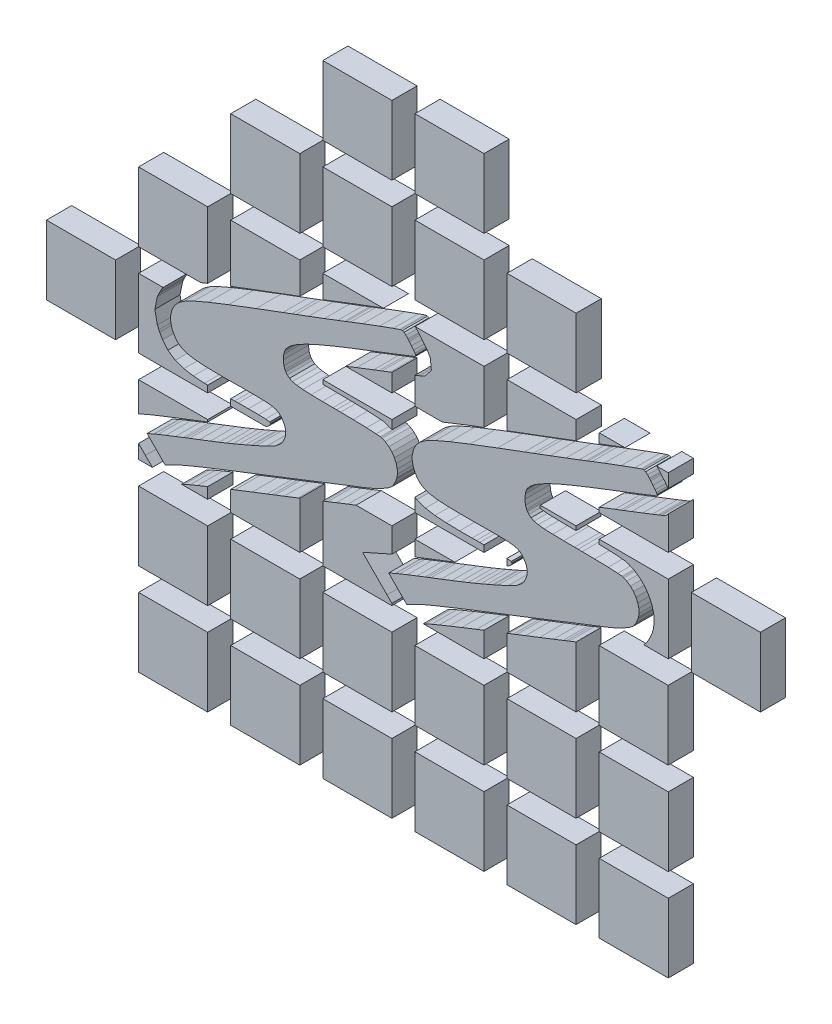
from build123d import *

# Parameters (mm, degrees)
AUFSATZ_LINEAR_AUSTRAGEN1_DEPTH       = 5
AUFSATZ_LINEAR_AUSTRAGEN1_2_DEPTH     = 5
AUFSATZ_LINEAR_AUSTRAGEN5_OUTLINE_W   = 13.7270744
AUFSATZ_LINEAR_AUSTRAGEN5_OUTLINE_H   = 13.727325352
AUFSATZ_LINEAR_AUSTRAGEN5_OUTLINE_W_2 = 13.730713204
AUFSATZ_LINEAR_AUSTRAGEN5_OUTLINE_W_3 = 13.73083868
AUFSATZ_LINEAR_AUSTRAGEN5_OUTLINE_H_2 = 13.730775942
AUFSATZ_LINEAR_AUSTRAGEN5_OUTLINE_W_4 = 13.72958392
AUFSATZ_LINEAR_AUSTRAGEN5_OUTLINE_W_5 = 13.730399514
AUFSATZ_LINEAR_AUSTRAGEN5_OUTLINE_H_3 = 13.730805993
AUFSATZ_LINEAR_AUSTRAGEN5_OUTLINE_W_6 = 13.7302113
AUFSATZ_LINEAR_AUSTRAGEN5_OUTLINE_H_4 = 13.73083868
AUFSATZ_LINEAR_AUSTRAGEN5_OUTLINE_H_5 = 13.73052499
AUFSATZ_LINEAR_AUSTRAGEN5_OUTLINE_W_7 = 13.73052499
AUFSATZ_LINEAR_AUSTRAGEN5_DEPTH       = 5


# Read off the part's stored shape, not the designer's step: Aufsatz-Linear austragen5
with BuildPart() as part:
    # Skizze1 → Aufsatz-Linear austragen1 (new body)
    with BuildSketch(Plane.XY):
        Polygon((16.2714138, 23.9861344), (14.4758116, 25.795478), (15.7643028, 26.368756), (15.9406804, 26.448766), (16.6710574, 26.747724), (18.1910188, 27.355546), (20.1078806, 28.107894), (21.6857032, 28.72105), (22.2135152, 28.922218), (22.8790968, 29.178504), (24.880058, 29.947616), (27.032454, 30.77845), (28.781244, 31.461964), (30.240474, 32.0421), (31.523428, 32.564324), (32.743136, 33.075626), (34.009326, 33.619948), (35.08146, 34.087054), (35.439854, 34.242756), (36.141148, 34.550096), (38.230552, 35.507676), (39.958768, 36.428426), (40.952162, 37.215318), (41.426126, 37.846254), (41.546268, 38.075362), (41.660568, 38.295834), (41.919394, 38.999922), (42.02836, 39.854378), (41.872404, 40.672766), (41.579034, 41.298368), (41.452288, 41.487344), (41.358562, 41.626282), (41.058334, 42.032682), (40.643298, 42.446194), (40.1005, 42.742612), (39.330118, 42.94124), (38.223694, 43.059604), (36.681406, 43.114722), (34.597844, 43.12285), (32.55162, 43.110404), (31.8709, 43.1038), (31.050988, 43.096688), (28.590998, 43.093894), (26.00731, 43.146472), (24.01595, 43.28414), (22.5235476, 43.531028), (21.426674, 43.911266), (20.63013, 44.448476), (20.0334332, 45.166534), (19.6476072, 45.853096), (19.5387428, 46.089824), (19.3830154, 46.42485), (19.0743546, 47.943262), (19.3844124, 49.460404), (19.5401144, 49.793906), (19.6434924, 50.017172), (20.011386, 50.660554), (20.7155756, 51.450494), (21.8910622, 52.2732), (23.778968, 53.240432), (26.617672, 54.465728), (30.649922, 56.057038), (36.112446, 58.127138), (41.46321, 60.123832), (43.248068, 60.786772), (44.075854, 61.095382), (46.559212, 62.02299), (49.70805, 63.206376), (52.338728, 64.202818), (53.694834, 64.722248), (54.0959, 64.87795), (54.903366, 65.195196), (57.33821, 66.12636), (60.663578, 67.37096), (63.388998, 68.358766), (64.64325, 68.793106), (64.83756, 68.841366), (64.922904, 68.86321), (65.19316, 68.874132), (65.527932, 68.750434), (65.908424, 68.427854), (66.281804, 68.008754), (66.400422, 67.864228), (66.546472, 67.684904), (66.98894, 67.1449), (67.416168, 66.614294), (67.693028, 66.239644), (67.83349, 65.985898), (67.85, 65.820544), (67.756274, 65.707768), (67.564504, 65.615312), (67.356732, 65.534032), (67.287644, 65.5066), (66.900802, 65.352168), (65.737482, 64.891666), (63.816226, 64.140588), (61.688722, 63.319406), (60.061344, 62.695328), (59.519816, 62.488572), (58.40374, 62.064138), (55.060338, 60.774072), (51.408834, 59.3217), (48.481738, 58.0898), (46.199548, 57.041034), (44.484032, 56.137048), (43.251878, 55.33771), (42.425362, 54.603396), (42.022772, 54.086506), (41.924982, 53.89499), (41.820334, 53.692552), (41.631612, 53.01869), (41.544744, 52.022248), (41.660568, 51.057556), (41.8658, 50.451512), (41.978576, 50.277776), (42.05884, 50.155094), (42.332906, 49.803812), (42.75861, 49.43856), (43.351446, 49.16551), (44.204378, 48.973994), (45.41164, 48.845978), (47.069244, 48.768762), (49.271424, 48.72736), (51.400452, 48.709326), (52.111398, 48.705516), (52.934104, 48.702722), (55.403746, 48.669448), (58.07989, 48.599344), (59.989716, 48.49876), (60.822074, 48.420274), (60.984634, 48.376078), (61.189866, 48.32096), (61.783972, 48.055022), (62.498982, 47.565818), (63.113662, 46.940216), (63.608454, 46.208188), (63.969388, 45.402246), (64.176144, 44.551854), (64.214752, 43.689524), (64.12636, 43.046904), (64.065654, 42.841672), (64.021712, 42.698416), (63.693798, 41.911778), (63.310766, 41.233852), (63.240662, 41.14419), (63.078102, 40.937434), (62.431672, 40.440102), (61.050928, 39.618666), (59.160152, 38.714426), (57.409838, 37.984176), (56.82005, 37.75964), (56.448194, 37.619178), (55.333388, 37.187632), (53.30215, 36.3982), (50.992528, 35.49269), (49.250596, 34.806382), (48.671984, 34.576258), (48.046128, 34.329624), (46.168052, 33.590992), (43.363638, 32.492696), (40.599356, 31.415228), (38.814752, 30.722062), (38.2209, 30.491938), (37.23284, 30.111446), (34.26866, 28.96362), (30.831786, 27.624278), (27.889704, 26.465276), (25.417522, 25.478486), (23.3958598, 24.6558562), (21.8015018, 23.9861344), (20.61362, 23.4638596), (20.0072712, 23.1799638), (19.8101926, 23.0766366), (18.0669906, 22.1753938), align=None)
    extrude(amount=AUFSATZ_LINEAR_AUSTRAGEN1_DEPTH)


with BuildPart() as body_2:
    # Skizze1 → Aufsatz-Linear austragen1 2 (new body)
    with BuildSketch(Plane.XY):
        Polygon((-31.7285862, 23.9861344), (-33.5241884, 25.795478), (-32.2356972, 26.368756), (-32.0593196, 26.448766), (-31.3289426, 26.747724), (-29.8089812, 27.355546), (-27.8921194, 28.107894), (-26.3142968, 28.72105), (-25.7864848, 28.922218), (-25.1209032, 29.178504), (-23.119942, 29.947616), (-20.967546, 30.77845), (-19.218756, 31.461964), (-17.759526, 32.0421), (-16.476572, 32.564324), (-15.256864, 33.075626), (-13.990674, 33.619948), (-12.91854, 34.087054), (-12.560146, 34.242756), (-11.858852, 34.550096), (-9.769448, 35.507676), (-8.041232, 36.428426), (-7.047838, 37.215318), (-6.573874, 37.846254), (-6.453732, 38.075362), (-6.339432, 38.295834), (-6.080606, 38.999922), (-5.97164, 39.854378), (-6.127596, 40.672766), (-6.420966, 41.298368), (-6.547712, 41.487344), (-6.641438, 41.626282), (-6.941666, 42.032682), (-7.356702, 42.446194), (-7.8995, 42.742612), (-8.669882, 42.94124), (-9.776306, 43.059604), (-11.318594, 43.114722), (-13.402156, 43.12285), (-15.44838, 43.110404), (-16.1291, 43.1038), (-16.949012, 43.096688), (-19.409002, 43.093894), (-21.99269, 43.146472), (-23.98405, 43.28414), (-25.4764524, 43.531028), (-26.573326, 43.911266), (-27.36987, 44.448476), (-27.9665668, 45.166534), (-28.3523928, 45.853096), (-28.4612572, 46.089824), (-28.6169846, 46.42485), (-28.9256454, 47.943262), (-28.6155876, 49.460404), (-28.4598856, 49.793906), (-28.3565076, 50.017172), (-27.988614, 50.660554), (-27.2844244, 51.450494), (-26.1089378, 52.2732), (-24.221032, 53.240432), (-21.382328, 54.465728), (-17.350078, 56.057038), (-11.887554, 58.127138), (-6.53679, 60.123832), (-4.751932, 60.786772), (-3.924146, 61.095382), (-1.440788, 62.02299), (1.70805, 63.206376), (4.338728, 64.202818), (5.694834, 64.722248), (6.0959, 64.87795), (6.903366, 65.195196), (9.33821, 66.12636), (12.663578, 67.37096), (15.388998, 68.358766), (16.64325, 68.793106), (16.83756, 68.841366), (16.922904, 68.86321), (17.19316, 68.874132), (17.527932, 68.750434), (17.908424, 68.427854), (18.281804, 68.008754), (18.400422, 67.864228), (18.546472, 67.684904), (18.98894, 67.1449), (19.416168, 66.614294), (19.693028, 66.239644), (19.83349, 65.985898), (19.85, 65.820544), (19.756274, 65.707768), (19.564504, 65.615312), (19.356732, 65.534032), (19.287644, 65.5066), (18.900802, 65.352168), (17.737482, 64.891666), (15.816226, 64.140588), (13.688722, 63.319406), (12.061344, 62.695328), (11.519816, 62.488572), (10.40374, 62.064138), (7.060338, 60.774072), (3.408834, 59.3217), (0.481738, 58.0898), (-1.800452, 57.041034), (-3.515968, 56.137048), (-4.748122, 55.33771), (-5.574638, 54.603396), (-5.977228, 54.086506), (-6.075018, 53.89499), (-6.179666, 53.692552), (-6.368388, 53.01869), (-6.455256, 52.022248), (-6.339432, 51.057556), (-6.1342, 50.451512), (-6.021424, 50.277776), (-5.94116, 50.155094), (-5.667094, 49.803812), (-5.24139, 49.43856), (-4.648554, 49.16551), (-3.795622, 48.973994), (-2.58836, 48.845978), (-0.930756, 48.768762), (1.271424, 48.72736), (3.400452, 48.709326), (4.111398, 48.705516), (4.934104, 48.702722), (7.403746, 48.669448), (10.07989, 48.599344), (11.989716, 48.49876), (12.822074, 48.420274), (12.984634, 48.376078), (13.189866, 48.32096), (13.783972, 48.055022), (14.498982, 47.565818), (15.113662, 46.940216), (15.608454, 46.208188), (15.969388, 45.402246), (16.176144, 44.551854), (16.214752, 43.689524), (16.12636, 43.046904), (16.065654, 42.841672), (16.021712, 42.698416), (15.693798, 41.911778), (15.310766, 41.233852), (15.240662, 41.14419), (15.078102, 40.937434), (14.431672, 40.440102), (13.050928, 39.618666), (11.160152, 38.714426), (9.409838, 37.984176), (8.82005, 37.75964), (8.448194, 37.619178), (7.333388, 37.187632), (5.30215, 36.3982), (2.992528, 35.49269), (1.250596, 34.806382), (0.671984, 34.576258), (0.046128, 34.329624), (-1.831948, 33.590992), (-4.636362, 32.492696), (-7.400644, 31.415228), (-9.185248, 30.722062), (-9.7791, 30.491938), (-10.76716, 30.111446), (-13.73134, 28.96362), (-17.168214, 27.624278), (-20.110296, 26.465276), (-22.582478, 25.478486), (-24.6041402, 24.6558562), (-26.1984982, 23.9861344), (-27.38638, 23.4638596), (-27.9927288, 23.1799638), (-28.1898074, 23.0766366), (-29.9330094, 22.1753938), align=None)
    extrude(amount=AUFSATZ_LINEAR_AUSTRAGEN1_2_DEPTH)


with BuildPart() as body_3:
    # Aufsatz-Linear austragen5 outline → Aufsatz-Linear austragen5 (new body)
    with BuildSketch(Plane.XY):
        with Locations((63.170323921, -9.257506107)):
            Rectangle(AUFSATZ_LINEAR_AUSTRAGEN5_OUTLINE_W, AUFSATZ_LINEAR_AUSTRAGEN5_OUTLINE_H)
        with Locations((-28.358520707, -9.257506107)):
            Rectangle(AUFSATZ_LINEAR_AUSTRAGEN5_OUTLINE_W_2, AUFSATZ_LINEAR_AUSTRAGEN5_OUTLINE_H)
        Polygon((69.791889523, 68.447274711), (70.033861121, 68.11983608), (70.033861121, 70.831189697), (67.712757645, 70.831189697), (68.008669318, 70.58031665), (68.562211184, 69.958994147), (68.722973789, 69.763118511), (68.869793501, 69.582849438), (69.31758842, 69.036344273), align=None)
        Polygon((56.306786721, 57.100351017), (70.033861121, 57.100351017), (70.033861121, 63.75463053), (69.646620371, 63.288682311), (68.764144303, 62.86322365), (68.45675874, 62.742975019), (68.397334021, 62.71937991), (68.00903859, 62.564367683), (66.835727939, 62.099910868), (64.902513705, 61.344158027), (62.765951051, 60.519479534), (61.133467494, 59.89344362), (60.588031464, 59.68519553), (59.476908475, 59.262645117), (56.306786721, 58.039440043), align=None)
        Polygon((65.209834986, 38.794971067), (70.033861121, 38.794971067), (70.033861121, 52.525496057), (56.306786721, 52.525496057), (56.306786721, 51.646821197), (58.198081541, 51.597277027), (60.2095164, 51.491341637), (61.360363238, 51.38282419), (61.767223597, 51.27220903), (62.198089669, 51.15649376), (63.255603859, 50.683121654), (64.434132909, 49.876781707), (65.445666486, 48.847274599), (66.23989638, 47.672238381), (66.819593992, 46.377811552), (67.160101445, 44.977296868), (67.223955695, 43.551078591), (67.067474101, 42.413439416), (66.938173676, 41.976306599), (66.846972637, 41.678980669), (66.393885648, 40.592063235), (65.812323712, 39.562760312), (65.601523381, 39.293149745), align=None)
        with Locations((63.170323921, 9.047873843)):
            Rectangle(AUFSATZ_LINEAR_AUSTRAGEN5_OUTLINE_W, AUFSATZ_LINEAR_AUSTRAGEN5_OUTLINE_H)
        Polygon((61.406488506, 70.831189697), (56.306786721, 70.831189697), (56.306786721, 68.943562398), (59.626632135, 70.186095435), align=None)
        with Locations((26.543879521, 9.063213284)):
            Rectangle(AUFSATZ_LINEAR_AUSTRAGEN5_OUTLINE_W_3, AUFSATZ_LINEAR_AUSTRAGEN5_OUTLINE_H_2)
        with Locations((44.842671981, 9.063213284)):
            Rectangle(AUFSATZ_LINEAR_AUSTRAGEN5_OUTLINE_W_4, AUFSATZ_LINEAR_AUSTRAGEN5_OUTLINE_H_2)
        with Locations((8.245306644, 9.063213284)):
            Rectangle(AUFSATZ_LINEAR_AUSTRAGEN5_OUTLINE_W_5, AUFSATZ_LINEAR_AUSTRAGEN5_OUTLINE_H_2)
        with Locations((-10.053140757, 9.063213284)):
            Rectangle(AUFSATZ_LINEAR_AUSTRAGEN5_OUTLINE_W_2, AUFSATZ_LINEAR_AUSTRAGEN5_OUTLINE_H_2)
        Polygon((21.350585172, 20.496366821), (33.409298861, 20.496366821), (33.409298861, 25.408980648), (31.926227688, 24.831031177), (28.99557046, 23.676529844), (26.538958283, 22.695954656), (24.542161846, 21.883442926), (22.986226204, 21.229860719), (21.853564868, 20.731864645), align=None)
        with Locations((26.543879521, -9.235343249)):
            Rectangle(AUFSATZ_LINEAR_AUSTRAGEN5_OUTLINE_W_3, AUFSATZ_LINEAR_AUSTRAGEN5_OUTLINE_H_3)
        Polygon((27.615160928, 34.227205501), (19.678460181, 34.227205501), (19.678460181, 31.159581081), (20.608144997, 31.520864931), (21.140289156, 31.723684071), (21.801920313, 31.978448931), (23.801725295, 32.747116514), (25.946239775, 33.574908214), align=None)
        Polygon((1.776279069, 31.786893429), (1.380106887, 31.630772005), (1.380106887, 20.496366821), (15.110506401, 20.496366821), (15.110506401, 20.896252678), (14.141607629, 21.873333883), (9.283348798, 26.76877204), (14.534865824, 29.105287165), (14.752377387, 29.203956725), (15.110506401, 29.350546135), (15.110506401, 34.227205501), (7.99768751, 34.227205501), (6.393040324, 33.603566205), (4.089893445, 32.70059484), (2.354791826, 32.016977958), align=None)
        with Locations((8.245306644, -9.235343249)):
            Rectangle(AUFSATZ_LINEAR_AUSTRAGEN5_OUTLINE_W_5, AUFSATZ_LINEAR_AUSTRAGEN5_OUTLINE_H_3)
        Polygon((-16.918497359, 24.498260704), (-16.918497359, 20.496366821), (-3.187784155, 20.496366821), (-3.187784155, 29.838145346), (-3.544612675, 29.698400167), (-6.312796755, 28.619411206), (-8.100160099, 27.925173437), (-8.698056904, 27.693482032), (-9.686455849, 27.312859507), (-12.645031624, 26.167203644), (-16.073772312, 24.831031177), align=None)
        with Locations((63.141150751, 27.361786161)):
            Rectangle(AUFSATZ_LINEAR_AUSTRAGEN5_OUTLINE_W_6, AUFSATZ_LINEAR_AUSTRAGEN5_OUTLINE_H_4)
        Polygon((37.977880021, 27.182879541), (37.977880021, 20.496366821), (51.707463941, 20.496366821), (51.707463941, 32.549920515), (50.354791826, 32.016977958), (49.776279069, 31.786893429), (49.145082543, 31.538154863), (47.264051672, 30.798360736), (44.455387325, 29.698400167), (41.687203245, 28.619411206), (39.899839901, 27.925173437), (39.301943096, 27.693482032), (38.313544151, 27.312859507), align=None)
        Polygon((38.010295898, 40.065315206), (37.977880021, 40.066473678), (37.977880021, 38.794971067), (38.020488043, 38.794971067), (38.308687366, 38.948516415), (38.786009922, 39.326615437), (38.881877547, 39.454233433), (38.886145101, 39.46237156), (38.910098013, 39.508574065), (38.98645307, 39.716283799), (38.990943944, 39.751498952), (38.96007517, 39.817325611), (38.907446192, 39.895342009), (38.855644117, 39.96546326), (38.793214971, 39.981559401), align=None)
        with Locations((44.842671981, -9.235343249)):
            Rectangle(AUFSATZ_LINEAR_AUSTRAGEN5_OUTLINE_W_4, AUFSATZ_LINEAR_AUSTRAGEN5_OUTLINE_H_3)
        with Locations((81.476017561, 45.660233562)):
            Rectangle(AUFSATZ_LINEAR_AUSTRAGEN5_OUTLINE_W, AUFSATZ_LINEAR_AUSTRAGEN5_OUTLINE_H_5)
        Polygon((19.692262541, 41.462482761), (19.692262541, 38.794971067), (33.423101221, 38.794971067), (33.423101221, 40.115649224), (32.575295097, 40.110492509), (31.898462224, 40.10392622), (31.065702536, 40.096702777), (28.562179688, 40.093859334), (25.873259903, 40.148578799), (23.666894749, 40.301110675), (21.782100289, 40.61291206), (20.07398024, 41.205042412), align=None)
        Polygon((-16.918497359, 40.096839829), (-16.918497359, 38.794971067), (-9.979511957, 38.794971067), (-9.691312634, 38.948516415), (-9.213990078, 39.326615437), (-9.118122453, 39.454233433), (-9.113854899, 39.46237156), (-9.089901987, 39.508574065), (-9.01354693, 39.716283799), (-9.009056056, 39.751498952), (-9.03992483, 39.817325611), (-9.092553808, 39.895342009), (-9.144355883, 39.96546326), (-9.206785029, 39.981559401), (-9.989704102, 40.065315206), (-11.378033038, 40.114931046), (-13.398883926, 40.122814409), (-15.424704903, 40.110492509), (-16.101537776, 40.10392622), align=None)
        with Locations((-46.663900657, 45.660233562)):
            Rectangle(AUFSATZ_LINEAR_AUSTRAGEN5_OUTLINE_W_2, AUFSATZ_LINEAR_AUSTRAGEN5_OUTLINE_H_5)
        Polygon((-35.223877309, 52.525496057), (-35.223877309, 38.794971067), (-21.493164105, 38.794971067), (-21.493164105, 40.13568554), (-22.126740097, 40.148578799), (-24.333105251, 40.301110675), (-26.217899711, 40.61291206), (-27.92601976, 41.205042412), (-29.402997535, 42.201154655), (-30.448241328, 43.458988897), (-31.027235366, 44.489285729), (-31.184305596, 44.830838352), (-31.486445608, 45.480850872), (-31.987327269, 47.944865493), (-31.48386477, 50.408354889), (-31.180228861, 51.058720222), (-31.024732502, 51.39454651), (-30.437001155, 52.422386543), (-30.345084493, 52.525496057), align=None)
        Polygon((-22.053760225, 33.574908214), (-21.493164105, 33.794017024), (-21.493164105, 34.220304321), (-35.223877309, 34.220304321), (-35.223877309, 28.322783764), (-33.465134176, 29.105287165), (-33.247622613, 29.203956725), (-32.454140493, 29.52874492), (-30.913983857, 30.144642855), (-28.983485647, 30.902343001), (-27.391855003, 31.520864931), (-26.859710844, 31.723684071), (-26.198079687, 31.978448931), (-24.198274705, 32.747116514), align=None)
        Polygon((-26.663416542, 20.489591117), (-21.493164105, 20.489591117), (-21.493164105, 22.682883811), (-23.457838154, 21.883442926), (-25.013773796, 21.229860719), (-26.146435132, 20.731864645), (-26.659493749, 20.491647816), align=None)
        Polygon((-22.527699917, 57.238879656), (-21.493164105, 57.647154734), (-21.493164105, 70.831189697), (-35.223877309, 70.831189697), (-35.223877309, 57.100351017), (-22.848636083, 57.100351017), align=None)
        with Locations((-28.358520707, 9.047873843)):
            Rectangle(AUFSATZ_LINEAR_AUSTRAGEN5_OUTLINE_W_2, AUFSATZ_LINEAR_AUSTRAGEN5_OUTLINE_H)
        Polygon((-33.858392371, 21.873333883), (-35.223877309, 23.249268616), (-35.223877309, 20.489591117), (-32.486237569, 20.489591117), align=None)
        with Locations((-10.053140757, 82.271463997)):
            Rectangle(AUFSATZ_LINEAR_AUSTRAGEN5_OUTLINE_W_2, AUFSATZ_LINEAR_AUSTRAGEN5_OUTLINE_H_4)
        Polygon((-3.187784155, 70.831189697), (-16.918497359, 70.831189697), (-16.918497359, 59.428787829), (-12.943535582, 60.935155283), (-7.583483496, 62.935315231), (-5.798197407, 63.598414233), (-4.973009782, 63.906055523), (-3.187784155, 64.572890339), align=None)
        with Locations((-10.053140757, -9.235343249)):
            Rectangle(AUFSATZ_LINEAR_AUSTRAGEN5_OUTLINE_W_2, AUFSATZ_LINEAR_AUSTRAGEN5_OUTLINE_H_3)
        with Locations((8.252145086, 100.576530257)):
            Rectangle(AUFSATZ_LINEAR_AUSTRAGEN5_OUTLINE_W_7, AUFSATZ_LINEAR_AUSTRAGEN5_OUTLINE_H_4)
        Polygon((15.117407581, 52.525496057), (1.386882591, 52.525496057), (1.386882591, 51.726489627), (3.421195862, 51.709257911), (4.124530618, 51.7054887), (4.959406755, 51.702653369), (7.463236758, 51.668918747), (10.198081541, 51.597277027), (12.2095164, 51.491341637), (13.360363238, 51.38282419), (13.767223597, 51.27220903), (14.198089669, 51.15649376), (15.117407581, 50.744982066), align=None)
        Polygon((13.406488506, 70.831189697), (1.386882591, 70.831189697), (1.386882591, 66.292723174), (3.2708621, 67.006332483), (4.615436981, 67.521345712), (5.004518873, 67.672395237), (5.819020563, 67.992405495), (8.276601431, 68.932264818), (11.626632135, 70.186095435), align=None)
        with Locations((8.252145086, 82.271463997)):
            Rectangle(AUFSATZ_LINEAR_AUSTRAGEN5_OUTLINE_W_7, AUFSATZ_LINEAR_AUSTRAGEN5_OUTLINE_H_4)
        with Locations((26.557681881, 100.576530257)):
            Rectangle(AUFSATZ_LINEAR_AUSTRAGEN5_OUTLINE_W_3, AUFSATZ_LINEAR_AUSTRAGEN5_OUTLINE_H_4)
        Polygon((5.941214753, 57.100351017), (15.117407581, 57.100351017), (15.117407581, 60.655136048), (14.765951051, 60.519479534), (13.133467494, 59.89344362), (12.588031464, 59.68519553), (11.476908475, 59.262645117), (8.154722693, 57.980765486), align=None)
        Polygon((20.00903859, 62.564367683), (19.692262541, 62.4389714), (19.692262541, 57.100351017), (25.151363917, 57.100351017), (25.472300083, 57.238879656), (29.567675279, 58.855101741), (33.423101221, 60.316169416), (33.423101221, 70.831189697), (19.712757645, 70.831189697), (20.008669318, 70.58031665), (20.562211184, 69.958994147), (20.722973789, 69.763118511), (20.869793501, 69.582849438), (21.31758842, 69.036344273), (21.791889523, 68.447274711), (22.222538159, 67.864516236), (22.757288386, 66.898484631), (22.95993233, 64.868927594), (21.646620372, 63.288682311), (20.764144303, 62.86322365), (20.45675874, 62.742975019), (20.397334021, 62.71937991), align=None)
        with Locations((26.557681881, 82.271463997)):
            Rectangle(AUFSATZ_LINEAR_AUSTRAGEN5_OUTLINE_W_3, AUFSATZ_LINEAR_AUSTRAGEN5_OUTLINE_H_4)
        with Locations((44.863375521, 82.271463997)):
            Rectangle(AUFSATZ_LINEAR_AUSTRAGEN5_OUTLINE_W_3, AUFSATZ_LINEAR_AUSTRAGEN5_OUTLINE_H_4)
        Polygon((51.728794861, 70.831189697), (37.997956181, 70.831189697), (37.997956181, 62.032803947), (40.416516504, 62.935315231), (42.201802593, 63.598414233), (43.026990218, 63.906055523), (45.506647084, 64.83228104), (48.649029763, 66.013241022), (51.2708621, 67.006332483), (51.728794861, 67.181734711), align=None)
        Polygon((51.421195862, 51.709257911), (51.707463941, 51.707723784), (51.707463941, 52.525496057), (44.609545432, 52.525496057), (44.608565625, 52.524238071), (44.595961642, 52.47923354), (44.560399289, 52.071306319), (44.573053691, 51.965908471), (44.692793475, 51.93902229), (45.639808478, 51.838602437), (47.167257238, 51.767449445), (49.312326143, 51.72712116), align=None)
    extrude(amount=AUFSATZ_LINEAR_AUSTRAGEN5_DEPTH)


solid = Compound([part.part, body_2.part, body_3.part])
